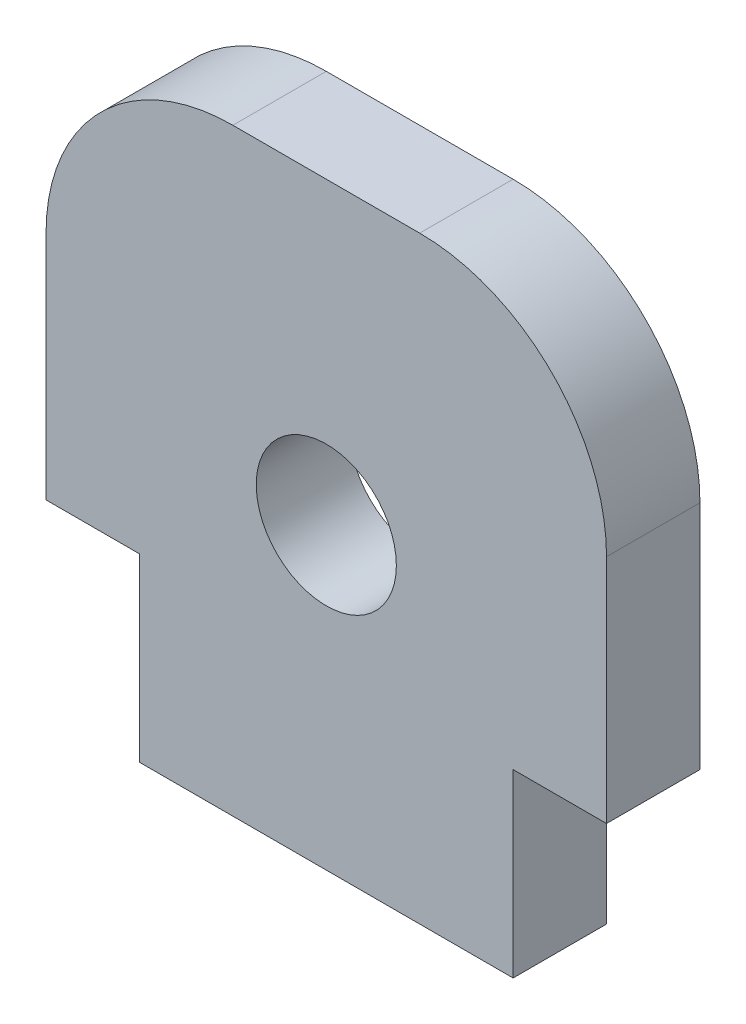
from build123d import *

# Parameters (mm, degrees)
SKETCH1_R           = 2.38125
BOSS_EXTRUDE1_DEPTH = 3.175
CAVITY1_START       = -3.175
CAVITY1_OUTLINE_W   = 1.236627981
CAVITY1_OUTLINE_H   = 3.175
CAVITY1_DEPTH       = 3.175
CAVITY1_START_2     = 12.7
CAVITY1_2_OUTLINE_W = 1.236627981
CAVITY1_2_OUTLINE_H = 3.175
CAVITY1_2_DEPTH     = 3.175


# Read off the part's stored shape, not the designer's step: Cavity1
with BuildPart() as part:
    # Sketch1 → Boss-Extrude1 (new body)
    with BuildSketch(Plane.XY):
        with BuildLine():
            Line((0, -1.722993842), (12.7, -1.722993842))
            Line((12.7, -1.722993842), (12.7, 3.175))
            Line((12.7, 3.175), (15.875, 3.175))
            Line((15.875, 3.175), (15.875, 12.264476338))
            ThreePointArc((15.875, 12.264476338), (14.015128061, 16.754604399), (9.525, 18.614476338))
            Line((9.525, 18.614476338), (3.175, 18.614476338))
            ThreePointArc((3.175, 18.614476338), (-1.315128061, 16.754604399), (-3.175, 12.264476338))
            Line((-3.175, 12.264476338), (-3.175, 3.175))
            Line((-3.175, 3.175), (0, 3.175))
            Line((0, 3.175), (0, -1.722993842))
        make_face()
        with Locations((6.35, 8.437006158)):
            Circle(SKETCH1_R, mode=Mode.SUBTRACT)
    extrude(amount=BOSS_EXTRUDE1_DEPTH)

    # Cavity1 outline → Cavity1 (cut)
    with BuildSketch(Plane.YZ.offset(CAVITY1_START)):
        with Locations((3.793313991, 1.5875)):
            Rectangle(CAVITY1_OUTLINE_W, CAVITY1_OUTLINE_H)
    extrude(amount=CAVITY1_DEPTH, mode=Mode.SUBTRACT)

    # Cavity1 2 outline → Cavity1 2 (cut)
    with BuildSketch(Plane.YZ.offset(CAVITY1_START_2)):
        with Locations((3.793313991, 1.5875)):
            Rectangle(CAVITY1_2_OUTLINE_W, CAVITY1_2_OUTLINE_H)
    extrude(amount=CAVITY1_2_DEPTH, mode=Mode.SUBTRACT)


solid = part.part
